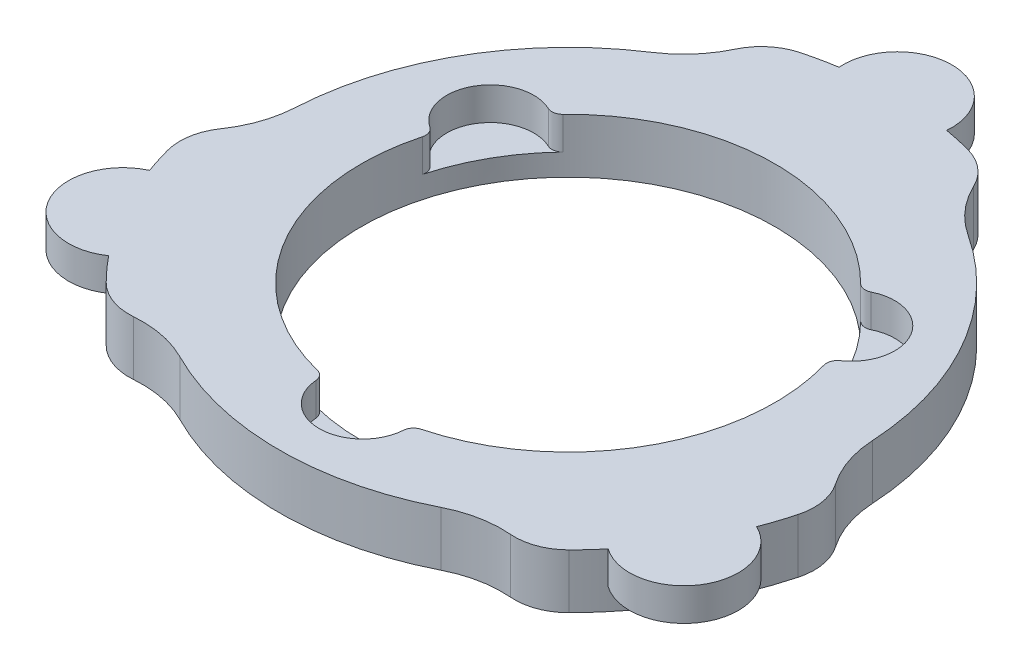
from build123d import *

# Parameters (mm, degrees)
SKETCH1_R                = 19
BOSS_EXTRUDE1_DEPTH      = 3.5
SKETCH2_R                = 30
SKETCH2_R_2              = 19
SKETCH2_R_3              = 2.8
BOSS_EXTRUDE2_DEPTH      = 5
BOSS_EXTRUDE3_DEPTH      = 2
BOSS_EXTRUDE3_DEPTH_BACK = 5
SKETCH4_R                = 2.9
SKETCH5_R                = 5
BOSS_EXTRUDE4_DEPTH      = 3
CUT_EXTRUDE1_START       = -10
SKETCH3_R                = 19
CUT_EXTRUDE1_DEPTH       = 10
CUT_EXTRUDE3_START       = -13
CUT_EXTRUDE3_DEPTH       = 13
FILLET1_R                = 10
FILLET2_R                = 5
CUT_EXTRUDE4_START       = -3
SKETCH8_R                = 4
SKETCH8_R_2              = 19
CUT_EXTRUDE4_DEPTH       = 3
FILLET3_R                = 1


with BuildPart() as part:
    # Sketch1 → Boss-Extrude1 (new body)
    with BuildSketch(Plane(origin=(0, 0, 0), x_dir=(1, 0, 0), z_dir=(0, 1, 0))):
        with Locations(Location((0, 0, 0), (0, 0, 270))):
            Circle(SKETCH1_R)
    extrude(amount=BOSS_EXTRUDE1_DEPTH)

    # Sketch2 → Boss-Extrude2 (add)
    with BuildSketch(Plane(origin=(0, 0, 0), x_dir=(1, 0, 0), z_dir=(0, 1, 0))):
        with Locations(Location((0, 0, 0), (0, 0, 270))):
            Circle(SKETCH2_R)
        with Locations(Location((0, 0, 0), (0, 0, 270))):
            Circle(SKETCH2_R_2, mode=Mode.SUBTRACT)
        with Locations(Location((0, 25, 0), (0, 0, 270))):
            Circle(SKETCH2_R_3, mode=Mode.SUBTRACT)
        with Locations(Location((21.650635095, -12.5, 0), (0, 0, 270))):
            Circle(SKETCH2_R_3, mode=Mode.SUBTRACT)
        with Locations(Location((-21.650635095, -12.5, 0), (0, 0, 270))):
            Circle(SKETCH2_R_3, mode=Mode.SUBTRACT)
    extrude(amount=BOSS_EXTRUDE2_DEPTH)

    # Sketch4 → Boss-Extrude3 (add, two sides: drawn at the far end of the back side and taken through both)
    with BuildSketch(Plane.XZ.offset(-BOSS_EXTRUDE3_DEPTH_BACK)):
        with Locations(Location((-21.650635095, 12.5, 0), (0, 0, 270))):
            Circle(SKETCH4_R)
        with Locations(Location((21.650635095, 12.5, 0), (0, 0, 270))):
            Circle(SKETCH4_R)
        with Locations(Location((0, -25, 0), (0, 0, 270))):
            Circle(SKETCH4_R)
    extrude(amount=BOSS_EXTRUDE3_DEPTH + BOSS_EXTRUDE3_DEPTH_BACK)

    # Sketch5 → Boss-Extrude4 (add)
    with BuildSketch(Plane(origin=(0, 5, 0), x_dir=(1, 0, 0), z_dir=(0, 1, 0))):
        with Locations((-26.103110985, -14.7860609)):
            Circle(SKETCH5_R)
        with Locations((0.246451131, 29.99898768)):
            Circle(SKETCH5_R)
        with Locations((25.856659853, -15.212926781)):
            Circle(SKETCH5_R)
    extrude(amount=-BOSS_EXTRUDE4_DEPTH)

    # Sketch3 → Cut-Extrude1 (cut)
    with BuildSketch(Plane(origin=(0, 3.5, 0), x_dir=(1, 0, 0), z_dir=(0, 1, 0)).offset(CUT_EXTRUDE1_START)):
        with Locations(Location((0, 0, 0), (0, 0, 270))):
            Circle(SKETCH3_R)
    extrude(amount=CUT_EXTRUDE1_DEPTH, mode=Mode.SUBTRACT)

    # Sketch7 → Cut-Extrude3 (cut)
    with BuildSketch(Plane(origin=(0, 5, 0), x_dir=(1, 0, 0), z_dir=(0, 1, 0)).offset(CUT_EXTRUDE3_START)):
        with BuildLine():
            ThreePointArc((-29.54423259, -5.20944533), (-25.980762114, 15), (-10.2606043, 28.190778624))
            Line((-10.2606043, 28.190778624), (-13.773984089, 37.84371026))
            Line((-13.773984089, 37.84371026), (-43.939319858, -7.747687605))
            Line((-43.939319858, -7.747687605), (-29.54423259, -5.20944533))
        make_face()
        with BuildLine():
            ThreePointArc((-26.13264562, -4.6078905), (-22.980662881, 13.267891901), (-9.075772579, 24.935480225))
            Line((-9.075772579, 24.935480225), (-10.2606043, 28.190778624))
            ThreePointArc((-10.2606043, 28.190778624), (-25.980762114, 15), (-29.54423259, -5.20944533))
            Line((-29.54423259, -5.20944533), (-26.13264562, -4.6078905))
        make_face()
        with BuildLine():
            Line((15.259965643, 41.926411025), (10.2606043, 28.190778624))
            ThreePointArc((10.2606043, 28.190778624), (25.980762114, 15), (29.54423259, -5.20944533))
            Line((29.54423259, -5.20944533), (39.660606503, -6.993234998))
            Line((39.660606503, -6.993234998), (15.259965643, 41.926411025))
        make_face()
        with BuildLine():
            Line((10.2606043, 28.190778624), (9.075772579, 24.935480225))
            ThreePointArc((9.075772579, 24.935480225), (21.736841548, 15.220300308), (26.535783801, 0))
            ThreePointArc((26.535783801, 0), (26.434807132, -2.312745947), (26.13264562, -4.6078905))
            Line((26.13264562, -4.6078905), (29.54423259, -5.20944533))
            ThreePointArc((29.54423259, -5.20944533), (25.980762114, 15), (10.2606043, 28.190778624))
        make_face()
        with BuildLine():
            Line((28.679354216, -34.17872342), (19.283628291, -22.981333294))
            ThreePointArc((19.283628291, -22.981333294), (0, -30), (-19.283628291, -22.981333294))
            Line((-19.283628291, -22.981333294), (-25.886622414, -30.850475262))
            Line((-25.886622414, -30.850475262), (28.679354216, -34.17872342))
        make_face()
        with BuildLine():
            Line((19.283628291, -22.981333294), (17.056873041, -20.327589725))
            ThreePointArc((17.056873041, -20.327589725), (0, -26.535783801), (-17.056873041, -20.327589725))
            Line((-17.056873041, -20.327589725), (-19.283628291, -22.981333294))
            ThreePointArc((-19.283628291, -22.981333294), (0, -30), (19.283628291, -22.981333294))
        make_face()
    extrude(amount=CUT_EXTRUDE3_DEPTH, mode=Mode.SUBTRACT)

    # Fillet1
    # the kernel refuses this fillet: 10 mm, written as the material it adds along each edge
    with BuildSketch(Plane(origin=(-26.13264562, 0, 4.6078905), x_dir=(-0.9848077530122318, 0, 0.17364817766679624), z_dir=(0, 1, 0)), Plane(origin=(17.056873041, 0, 20.327589725), x_dir=(0.6427876096865569, 0, 0.7660444431189634), z_dir=(0, 1, 0)), Plane(origin=(9.075772579, 0, -24.935480225), x_dir=(0.34202014332561265, 0, -0.9396926207859289), z_dir=(0, 1, 0))) as fillet1_piece_1:
        with BuildLine():
            CenterArc((9.045274498, -8.297697769), FILLET1_R, 123.92490422, 42.948020906)
            Line((-0.693413056, -6.026582466), (-0.888186807, -5.98116016))
            ThreePointArc((-0.888186807, -5.98116016), (-0.372612378, -3.01031053), (-0.2, 0))
            Line((-0.2, 0), (0, 0.2))
            ThreePointArc((0, 0.2), (1.732108099, 0.2), (3.352595033, 0.165953955))
            Line((3.352595033, 0.165953955), (3.464216199, 0))
        make_face()
    extrude(amount=5)
    with BuildSketch(Plane(origin=(-17.056873041, 0, 20.327589725), x_dir=(0.8344973728156843, 0, 0.551011918894429), z_dir=(0, 1, 0)), Plane(origin=(26.13264562, 0, 4.6078905), x_dir=(0.059941633142754296, 0, -0.99820188369697), z_dir=(0, 1, 0)), Plane(origin=(-9.075772579, 0, -24.935480225), x_dir=(-0.8944390059584274, 0, 0.44718996480254386), z_dir=(0, 1, 0))) as fillet1_piece_2:
        with BuildLine():
            CenterArc((7.20939257, -9.934457095), FILLET1_R, 96.563537437, 42.948020906)
            Line((-0.39597707, -3.441510719), (-0.548084463, -3.311651792))
            ThreePointArc((-0.548084463, -3.311651792), (-0.396677677, -1.697894369), (-0.198689142, 0.022860991))
            Line((-0.198689142, 0.022860991), (0.022860991, 0.198689142))
            ThreePointArc((0.022860991, 0.198689142), (3.03317152, 0.026076764), (6.04348205, 0.198689142))
            Line((6.04348205, 0.198689142), (6.06634304, 0))
        make_face()
    extrude(amount=5)

    # Fillet2
    fillet2_edges = [part.edges().sort_by_distance(p)[0] for p in [
        (-10.2606043, 2.5, -28.190778624),
        (-29.54423259, 2.5, 5.20944533),
        (-19.283628291, 2.5, 22.981333294),
        (19.283628291, 2.5, 22.981333294),
        (29.54423259, 2.5, 5.20944533),
        (10.2606043, 2.5, -28.190778624),
    ]]
    fillet(fillet2_edges, radius=FILLET2_R)

    # Sketch8 → Cut-Extrude4 (cut)
    with BuildSketch(Plane(origin=(0, 5, 0), x_dir=(1, 0, 0), z_dir=(0, 1, 0)).offset(CUT_EXTRUDE4_START)):
        with Locations((-16.524893724, 9.376987118)):
            Circle(SKETCH8_R)
        with Locations(Location((0, 0, 0), (0, 0, 42.512080704))):
            Circle(SKETCH8_R_2)
        with Locations((16.383155917, 9.622484201)):
            Circle(SKETCH8_R)
        with Locations((0.141737807, -18.999471319)):
            Circle(SKETCH8_R)
    extrude(amount=CUT_EXTRUDE4_DEPTH, mode=Mode.SUBTRACT)

    # Fillet3
    # the kernel refuses this fillet: 1 mm, written as the material it takes off along each edge
    with BuildSketch(Plane(origin=(-18.121826323, 6.950278825, -5.709589366), x_dir=(-0.28086097725665193, 0, 0.9597484625955065), z_dir=(0, -1, 0)), Plane(origin=(14.005562597, 6.950278825, -12.839167276), x_dir=(-0.6907360612225409, 0, -0.7231069725336425), z_dir=(0, -1, 0))) as fillet3_piece_1:
        with BuildLine():
            CenterArc((0.800640781, 0.999789253), FILLET3_R, 197.486602821, 71.337075115)
            ThreePointArc((-0.153146456, 0.699306464), (-0.060897436, 0.353086193), (0, 0))
            ThreePointArc((0, 0), (0.390055765, 0.004004198), (0.78011153, 0))
        make_face()
    extrude(amount=4.950278825, mode=Mode.SUBTRACT)
    with BuildSketch(Plane(origin=(-14.195555863, 6.950278825, -12.628784333), x_dir=(-0.8617980531882996, 0, -0.5072515308216002), z_dir=(0, -1, 0)), Plane(origin=(18.034625983, 6.950278825, -5.979319831), x_dir=(0.8701917383942803, 0, -0.49271324158209956), z_dir=(0, -1, 0))) as fillet3_piece_2:
        with BuildLine():
            CenterArc((0.805364366, 0.995988176), FILLET3_R, 193.528948716, 71.337075115)
            ThreePointArc((-0.166887482, 0.762051552), (-0.079532242, 0.381882385), (0, 0))
            ThreePointArc((0, 0), (0.357939718, 0.016047295), (0.715879437, 0))
        make_face()
    extrude(amount=4.950278825, mode=Mode.SUBTRACT)
    with BuildSketch(Plane(origin=(4.116263726, 6.950278825, 18.548756641), x_dir=(0.023311579398747933, 0, 0.9997282482084497), z_dir=(0, -1, 0))) as fillet3_piece_3:
        with BuildLine():
            CenterArc((0.805364366, -0.995988176), FILLET3_R, 95.133976169, 71.337075115)
            ThreePointArc((-0.166887482, -0.762051552), (-0.079532242, -0.381882385), (0, 0))
            ThreePointArc((0, 0), (0.357939718, -0.016047295), (0.715879437, 0))
        make_face()
    extrude(amount=4.950278825, mode=Mode.SUBTRACT)
    with BuildSketch(Plane(origin=(-3.83907012, 6.950278825, 18.608104165), x_dir=(-0.9750194381231715, 0, -0.22211955177780904), z_dir=(0, -1, 0))) as fillet3_piece_4:
        with BuildLine():
            CenterArc((0.800640781, -0.999789253), FILLET3_R, 91.176322064, 71.337075115)
            ThreePointArc((-0.153146456, -0.699306464), (-0.060897436, -0.353086193), (0, 0))
            ThreePointArc((0, 0), (0.390055765, -0.004004198), (0.78011153, 0))
        make_face()
    extrude(amount=4.950278825, mode=Mode.SUBTRACT)


solid = part.part
